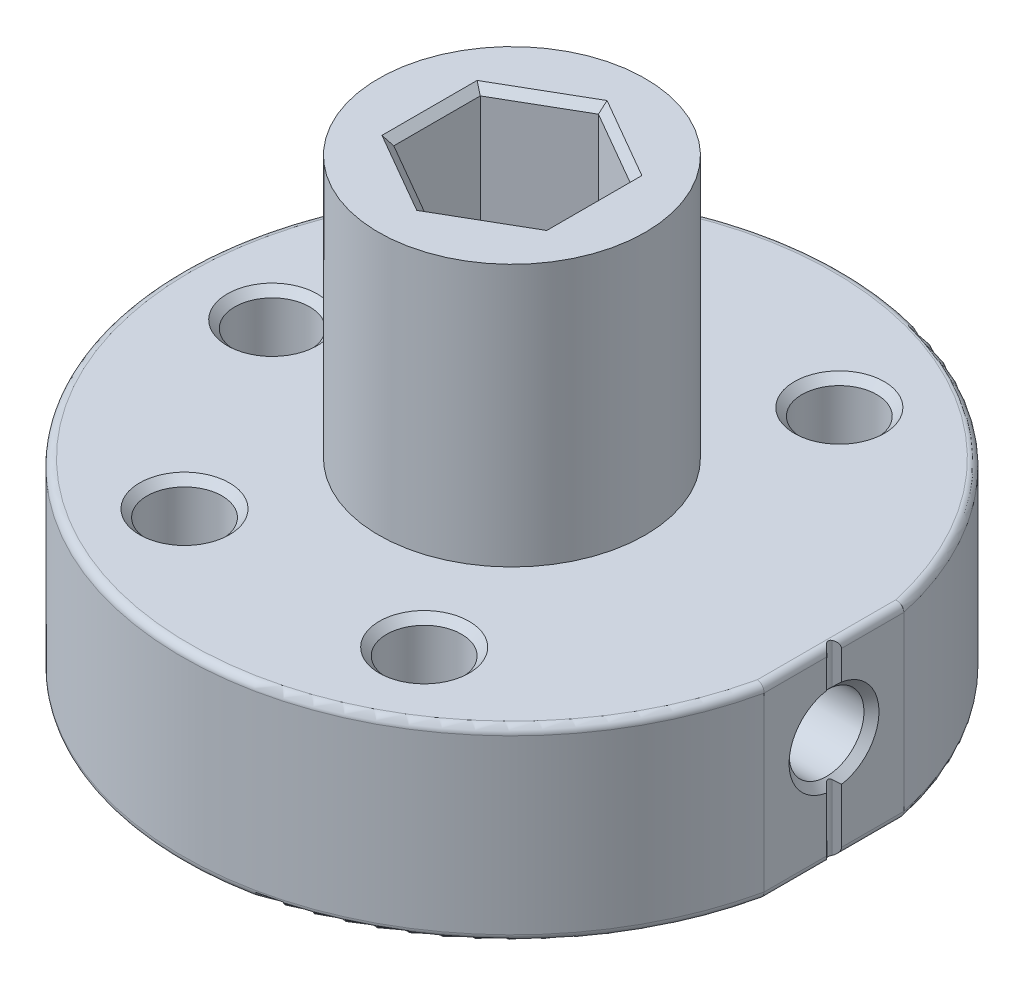
from build123d import *

# Parameters (mm, degrees)
CORTE_EXTRUS_O1_START            = -6.25
CORTE_EXTRUS_O1_OUTLINE_R        = 4.55
CORTE_EXTRUS_O1_DEPTH            = 6.25
CORTE_EXTRUS_O1_START_2          = -15
CORTE_EXTRUS_O1_2_OUTLINE_R      = 4.45
CORTE_EXTRUS_O1_2_DEPTH          = 12.640520374
CORTE_EXTRUS_O1_3_DEPTH          = 4.2
CORTE_EXTRUS_O1_4_DEPTH          = 3.890520374
CORTE_EXTRUS_O1_START_3          = 2.5
CORTE_EXTRUS_O1_5_DEPTH          = 3.5
CORTE_EXTRUS_O2_REACH            = 23.61
CORTE_EXTRUS_O3_REACH            = 19.848
FURO_DE_DI_METRO_2_5_2_5_1_D     = 2.5
FURO_DE_DI_METRO_2_5_2_5_1_DEPTH = 15
FURO_DE_DI_METRO_2_5_2_5_2_D     = 2.5
CHANFRO1_SIZE                    = 0.25
FILETE1_R                        = 0.25


with BuildPart() as part:
    # Corte-extrusão1: read off the stored shape, not the designer's step
    # Corte-extrusão1 outline → Corte-extrusão1 (new body)
    with BuildSketch(Plane.XZ.offset(15).offset(CORTE_EXTRUS_O1_START)):
        with BuildLine():
            Line((10.75, -2.331844763), (10.75, 2.331844763))
            ThreePointArc((10.75, 2.331844763), (-11, 0), (10.75, -2.331844763))
        make_face()
        Circle(CORTE_EXTRUS_O1_OUTLINE_R, mode=Mode.SUBTRACT)
    extrude(amount=CORTE_EXTRUS_O1_DEPTH)



with BuildPart() as body_2:
    # Corte-extrus_o1 2 outline → Corte-extrus_o1 2 (new body)
    with BuildSketch(Plane.XZ.offset(15).offset(CORTE_EXTRUS_O1_START_2)):
        Circle(CORTE_EXTRUS_O1_2_OUTLINE_R)
        Polygon((2.5, -1.443375673), (0, -2.886751346), (-2.5, -1.443375673), (-2.5, 1.443375673), (0, 2.886751346), (2.5, 1.443375673), align=None, mode=Mode.SUBTRACT)
    extrude(amount=CORTE_EXTRUS_O1_2_DEPTH)


with BuildPart() as part_1:
    add(part.part)

    add(body_2.part)  # Corte-extrus_o1 3 merges body 2
    # Corte-extrus_o1 3 outline → Corte-extrus_o1 3 (add)
    with BuildSketch(Plane.XZ.offset(15).offset(CORTE_EXTRUS_O1_START)):
        with BuildLine():
            Line((2.5, -0.381), (2.5, -1.443375673))
            Line((2.5, -1.443375673), (0, -2.886751346))
            Line((0, -2.886751346), (-2.5, -1.443375673))
            Line((-2.5, -1.443375673), (-2.5, 1.443375673))
            Line((-2.5, 1.443375673), (0, 2.886751346))
            Line((0, 2.886751346), (2.5, 1.443375673))
            Line((2.5, 1.443375673), (2.5, 0.381))
            Line((2.5, 0.381), (4.534020181, 0.381))
            ThreePointArc((4.534020181, 0.381), (-4.55, 0), (4.534020181, -0.381))
            Line((4.534020181, -0.381), (2.5, -0.381))
        make_face()
    extrude(amount=CORTE_EXTRUS_O1_3_DEPTH)

    # Corte-extrus_o1 4 outline → Corte-extrus_o1 4 (add)
    with BuildSketch(Plane.XZ.offset(15).offset(CORTE_EXTRUS_O1_START)):
        with BuildLine():
            ThreePointArc((4.433659775, 0.381), (4.45, 0), (4.433659775, -0.381))
            Line((4.433659775, -0.381), (4.534020181, -0.381))
            ThreePointArc((4.534020181, -0.381), (4.55, 0), (4.534020181, 0.381))
            Line((4.534020181, 0.381), (4.433659775, 0.381))
        make_face()
    extrude(amount=CORTE_EXTRUS_O1_4_DEPTH)

    # Corte-extrus_o1 5 outline → Corte-extrus_o1 5 (add)
    with BuildSketch(Plane.YZ.offset(CORTE_EXTRUS_O1_START_3)):
        with BuildLine():
            Line((-12.640520474, -0.381), (-12.640520474, 0.381))
            ThreePointArc((-12.640520474, 0.381), (-12.7, 0), (-12.640520474, -0.381))
        make_face()
    extrude(amount=CORTE_EXTRUS_O1_5_DEPTH)

    # Corte-extrusão2: up to this cone (the profile starts outside it)
    corte_extrus_o2_end = Plane(origin=(10.673877, -11.45, 0), z_dir=(1, 0, 0)).offset(-1.423876) * Cone(1e-06, 26.957754, 26.957753, align=(Align.CENTER, Align.CENTER, Align.MIN), mode=Mode.PRIVATE)
    # Esboço2 → Corte-extrusão2 (cut, up to the surface)
    with BuildSketch(Plane.XZ.offset(15), mode=Mode.PRIVATE) as corte_extrus_o2_sk1:
        with BuildLine():
            Line((10.75, -0.25), (10.75, 0.25))
            Line((10.75, 0.25), (10.588388348, 0.088388348))
            ThreePointArc((10.588388348, 0.088388348), (10.551776695, 0), (10.588388348, -0.088388348))
            Line((10.588388348, -0.088388348), (10.75, -0.25))
        make_face()
    corte_extrus_o2_tool1 = extrude(corte_extrus_o2_sk1.sketch, amount=-CORTE_EXTRUS_O2_REACH, mode=Mode.PRIVATE) - corte_extrus_o2_end
    add(corte_extrus_o2_tool1.solids().sort_by_distance((10.673877, -15, 0))[0], mode=Mode.SUBTRACT)

    # Corte-extrusão3: up to this cone (the profile starts outside it)
    corte_extrus_o3_end = Plane(origin=(10.673877, -11.45, 0), z_dir=(1, 0, 0)).offset(-1.423876) * Cone(1e-06, 23.195754, 23.195753, align=(Align.CENTER, Align.CENTER, Align.MIN), mode=Mode.PRIVATE)
    # Esboço3 → Corte-extrusão3 (cut, up to the surface)
    with BuildSketch(Plane(origin=(0, -8.75, 0), x_dir=(-1, 0, 0), z_dir=(0, 1, 0)), mode=Mode.PRIVATE) as corte_extrus_o3_sk1:
        with BuildLine():
            Line((-10.75, 0.25), (-10.75, -0.25))
            Line((-10.75, -0.25), (-10.588388348, -0.088388348))
            ThreePointArc((-10.588388348, -0.088388348), (-10.551776695, 0), (-10.588388348, 0.088388348))
            Line((-10.588388348, 0.088388348), (-10.75, 0.25))
        make_face()
    corte_extrus_o3_tool1 = extrude(corte_extrus_o3_sk1.sketch, amount=-CORTE_EXTRUS_O3_REACH, mode=Mode.PRIVATE) - corte_extrus_o3_end
    add(corte_extrus_o3_tool1.solids().sort_by_distance((10.673877, -8.75, 0))[0], mode=Mode.SUBTRACT)

    # Esboço4 → Corte-Revolução1 (revolve, cut)
    with BuildSketch(Plane(origin=(0, 0, 0), x_dir=(-1, 0, 0), z_dir=(0, 0, -1)), mode=Mode.PRIVATE) as corte_revolu_o1_sk:
        Polygon((-10.75, -9.95), (-10.75, -11.45), (-2.5, -11.45), (-2.5, -10.2), (-10.5, -10.2), align=None)
    revolve(corte_revolu_o1_sk.sketch.rotate(Axis((10.75, -11.45, 0), (-1, 0, 0)), 9.594068227), axis=Axis((10.75, -11.45, 0), (-1, 0, 0)), mode=Mode.SUBTRACT)

    # Furo de diâmetro Ø2.5 (2.5)1
    with Locations(Plane(origin=(0, -15, 0), x_dir=(-1, 0, 0), z_dir=(0, -1, 0))):
        with Locations((-4, -6.92820323), (8, 0)):
            Hole(FURO_DE_DI_METRO_2_5_2_5_1_D / 2, depth=FURO_DE_DI_METRO_2_5_2_5_1_DEPTH)

    # Furo de diâmetro Ø2.5 (2.5)2 (through all)
    with Locations(Plane(origin=(0, -8.75, 0), x_dir=(1, 0, 0), z_dir=(0, 1, 0))):
        with Locations((-4, -6.92820323), (4, 6.92820323), (-4, 6.92820323)):
            Hole(FURO_DE_DI_METRO_2_5_2_5_2_D / 2)

    # Chanfro1
    chanfro1_edges = [part_1.edges().sort_by_distance(p)[0] for p in [
        (1.25, 0, 2.165063509),
        (-1.25, 0, 2.165063509),
        (-2.5, 0, 0),
        (-1.25, 0, -2.165063509),
        (1.25, 0, -2.165063509),
        (2.5, 0, 0),
        (-4.55, -15, 0),
        (-9.25, -8.75, 0),
        (-9.25, -15, 0),
        (2.75, -8.75, 6.92820323),
        (2.75, -15, 6.92820323),
        (-2.75, -8.75, -6.92820323),
        (-2.75, -15, -6.92820323),
        (5.25, -8.75, -6.92820323),
        (5.25, -15, -6.92820323),
        (-2.75, -8.75, 6.92820323),
        (-2.75, -15, 6.92820323),
    ]]
    chamfer(chanfro1_edges, length=CHANFRO1_SIZE)

    # Filete1
    # the kernel refuses this fillet: 0.25 mm, written as the material it takes off along each edge
    with BuildSketch(Plane(origin=(10.75, -8.75, -3.394344763), x_dir=(-1, 0, 0), z_dir=(0, 0, 1)), Plane(origin=(10.75, -15, -0.375), x_dir=(0, 1, 0), z_dir=(0, 0, 1)), Plane(origin=(10.75, -15, -3.394344763), x_dir=(0, 1, 0), z_dir=(0, 0, 1)), Plane(origin=(10.75, -8.75, -0.375), x_dir=(-1, 0, 0), z_dir=(0, 0, 1))) as filete1_piece_1:
        with BuildLine():
            CenterArc((FILETE1_R, FILETE1_R), FILETE1_R, 180, 90)
            Line((0, FILETE1_R), (0, 0))
            Line((0, 0), (FILETE1_R, 0))
        make_face()
    extrude(amount=3.769344763, mode=Mode.SUBTRACT)
    with BuildSketch(Plane(origin=(0, -8.75, 0), x_dir=(0.9877835196921515, 0, 0.15583234011136815), z_dir=(0.15583234011136815, 0, -0.9877835196921515))) as filete1_piece_2:
        with BuildLine():
            CenterArc((11 - FILETE1_R, FILETE1_R), FILETE1_R, 270, 90)
            Line((11, FILETE1_R), (11, 0))
            Line((11, 0), (11 - FILETE1_R, 0))
        make_face()
    revolve(axis=Axis((0, -8.75, 0), (0, -1, 0)), revolution_arc=342.069855141, mode=Mode.SUBTRACT)
    with BuildSketch(Plane(origin=(0, -15, 0), x_dir=(0.9877835196921515, 0, 0.15583234011136815), z_dir=(0.15583234011136815, 0, -0.9877835196921515))) as filete1_piece_3:
        with BuildLine():
            CenterArc((11 - FILETE1_R, -FILETE1_R), FILETE1_R, 0, 90)
            Line((11 - FILETE1_R, 0), (11, 0))
            Line((11, 0), (11, -FILETE1_R))
        make_face()
    revolve(axis=Axis((0, -15, 0), (0, -1, 0)), revolution_arc=342.069855141, mode=Mode.SUBTRACT)


solid = part_1.part
